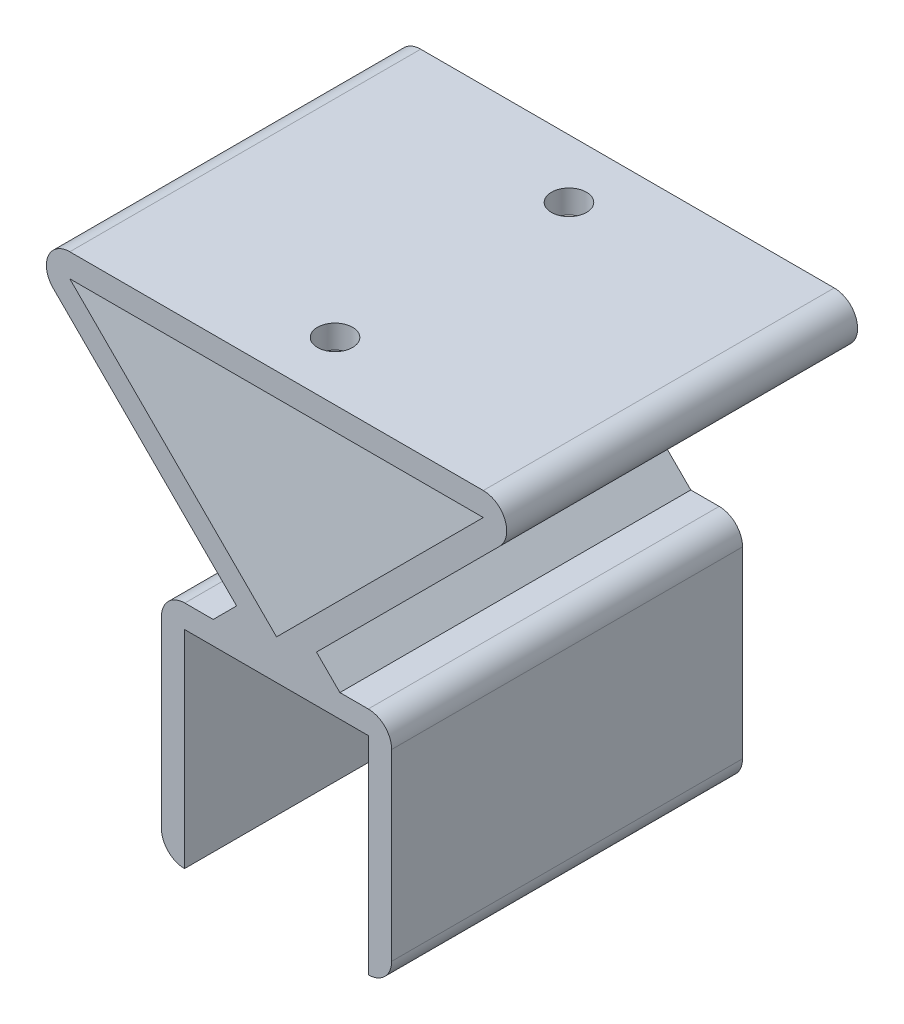
from build123d import *
from OCP.BRepFilletAPI import BRepFilletAPI_MakeChamfer

# Parameters (mm, degrees)
BOSS_EXTRUDE1_DEPTH = 38.1
CHAMFER1_SIZE       = 2.54
BOSS_EXTRUDE2_DEPTH = 38.1
CHAMFER2_SIZE       = 5.08
CHAMFER2_SIZE2      = 3.592102448
FILLET1_R           = 2.54
CUT_EXTRUDE1_REACH  = 70.978
SKETCH3_R           = 1.905


with BuildPart() as part:
    # Sketch1 → Boss-Extrude1 (new body)
    with BuildSketch(Plane.XY):
        Polygon((0, -3.592102448), (28.582742751, 24.990640303), (-28.582742751, 24.990640303), align=None)
        Polygon((0, 0), (22.450640303, 22.450640303), (-22.450640303, 22.450640303), align=None, mode=Mode.SUBTRACT)
    extrude(amount=BOSS_EXTRUDE1_DEPTH)

    # Chamfer1
    chamfer1_edges = [part.edges().sort_by_distance(p)[0] for p in [
        (0, -3.592102448, 19.05),
    ]]
    chamfer(chamfer1_edges, length=CHAMFER1_SIZE)

    # Sketch2 → Boss-Extrude2 (add)
    with BuildSketch(Plane.XY.offset(38.1)):
        Polygon((0, -1.796051224), (12.5, -1.796051224), (12.5, -26.796051224), (10, -26.796051224), (10, -24.296051224), (10, -4.296051224), (0, -4.296051224), (-10, -4.296051224), (-10, -24.296051224), (-10, -26.796051224), (-12.5, -26.796051224), (-12.5, -1.796051224), align=None)
    extrude(amount=-BOSS_EXTRUDE2_DEPTH)

    # Chamfer2: one chamfer whose edges measure the first distance from different faces: ONE call of the kernel's chamfer builder (chamfer() names one face for all edges)
    chamfer2_edges_1 = [part.edges().sort_by_distance(p)[0] for p in [
        (-1.796051224, -1.796051224, 19.05),
    ]]
    chamfer2_side_1 = [part.faces().sort_by_distance(p)[0] for p in [
        (-7.148025612, -1.796051224, 19.05),
    ]]
    chamfer2_edges_2 = [part.edges().sort_by_distance(p)[0] for p in [
        (1.796051224, -1.796051224, 19.05),
    ]]
    chamfer2_side_2 = [part.faces().sort_by_distance(p)[0] for p in [
        (7.148025612, -1.796051224, 19.05),
    ]]
    chamfer2 = BRepFilletAPI_MakeChamfer(part.part.solid().wrapped)
    for e in chamfer2_edges_1:
        chamfer2.Add(CHAMFER2_SIZE, CHAMFER2_SIZE2, e.wrapped, chamfer2_side_1[0].wrapped)  # the first distance lies on this face
    for e in chamfer2_edges_2:
        chamfer2.Add(CHAMFER2_SIZE, CHAMFER2_SIZE2, e.wrapped, chamfer2_side_2[0].wrapped)  # the first distance lies on this face
    add(Compound.cast(chamfer2.Shape()), mode=Mode.REPLACE)

    # Fillet1
    # the kernel refuses this fillet: 2.54 mm, written as the material it takes off along each edge
    with BuildSketch(Plane(origin=(-12.5, -26.796051224, 44.45), x_dir=(1, 0, 0), z_dir=(0, 0, -1)), Plane(origin=(12.5, -1.796051224, 44.45), x_dir=(-1, 0, 0), z_dir=(0, 0, -1)), Plane(origin=(12.5, -26.796051224, 44.45), x_dir=(0, 1, 0), z_dir=(0, 0, -1))) as fillet1_piece_1:
        with BuildLine():
            CenterArc((FILLET1_R, -FILLET1_R), FILLET1_R, 90, 90)
            Line((0, -FILLET1_R), (0, 0))
            Line((0, 0), (FILLET1_R, 0))
        make_face()
    extrude(amount=50.8, mode=Mode.SUBTRACT)
    with BuildSketch(Plane(origin=(-12.5, -1.796051224, 44.45), x_dir=(1, 0, 0), z_dir=(0, 0, -1))) as fillet1_piece_2:
        with BuildLine():
            CenterArc((FILLET1_R, FILLET1_R), FILLET1_R, 180, 90)
            Line((0, FILLET1_R), (0, 0))
            Line((0, 0), (FILLET1_R, 0))
        make_face()
    extrude(amount=50.8, mode=Mode.SUBTRACT)
    with BuildSketch(Plane(origin=(-28.582742751, 24.990640303, -15.330256121), x_dir=(1, 0, 0), z_dir=(0, 0, 1)), Plane(origin=(28.582742751, 24.990640303, -15.330256121), x_dir=(-0.7071067811865476, -0.7071067811865476, 0), z_dir=(0, 0, 1))) as fillet1_piece_3:
        with BuildLine():
            CenterArc((FILLET1_R * 2.41421356237, -FILLET1_R), FILLET1_R, 90, 135)
            Line((FILLET1_R * 1.70710678119, -FILLET1_R * 1.70710678119), (0, 0))
            Line((0, 0), (FILLET1_R * 2.41421356237, 0))
        make_face()
    extrude(amount=68.760512242, mode=Mode.SUBTRACT)

    # Sketch3 → Cut-Extrude1 (cut, up to next)
    with BuildSketch(Plane(origin=(0, 24.990640303, 0), x_dir=(1, 0, 0), z_dir=(0, 1, 0)), mode=Mode.PRIVATE) as cut_extrude1_sk1:
        with Locations(Location((0, -31.75, 0), (0, 0, 180))):
            Circle(SKETCH3_R)
    cut_extrude1_tool1 = extrude(cut_extrude1_sk1.sketch, amount=-CUT_EXTRUDE1_REACH, mode=Mode.PRIVATE) & part.part
    # Sketch3 → Cut-Extrude1 (cut, up to next)
    with BuildSketch(Plane(origin=(0, 24.990640303, 0), x_dir=(1, 0, 0), z_dir=(0, 1, 0)), mode=Mode.PRIVATE) as cut_extrude1_sk2:
        with Locations(Location((0, -6.35, 0), (0, 0, 180))):
            Circle(SKETCH3_R)
    cut_extrude1_tool2 = extrude(cut_extrude1_sk2.sketch, amount=-CUT_EXTRUDE1_REACH, mode=Mode.PRIVATE) & part.part
    add(cut_extrude1_tool1.solids().sort_by_distance((0, 24.99064, 31.75))[0], mode=Mode.SUBTRACT)
    add(cut_extrude1_tool2.solids().sort_by_distance((0, 24.99064, 6.35))[0], mode=Mode.SUBTRACT)


solid = part.part
